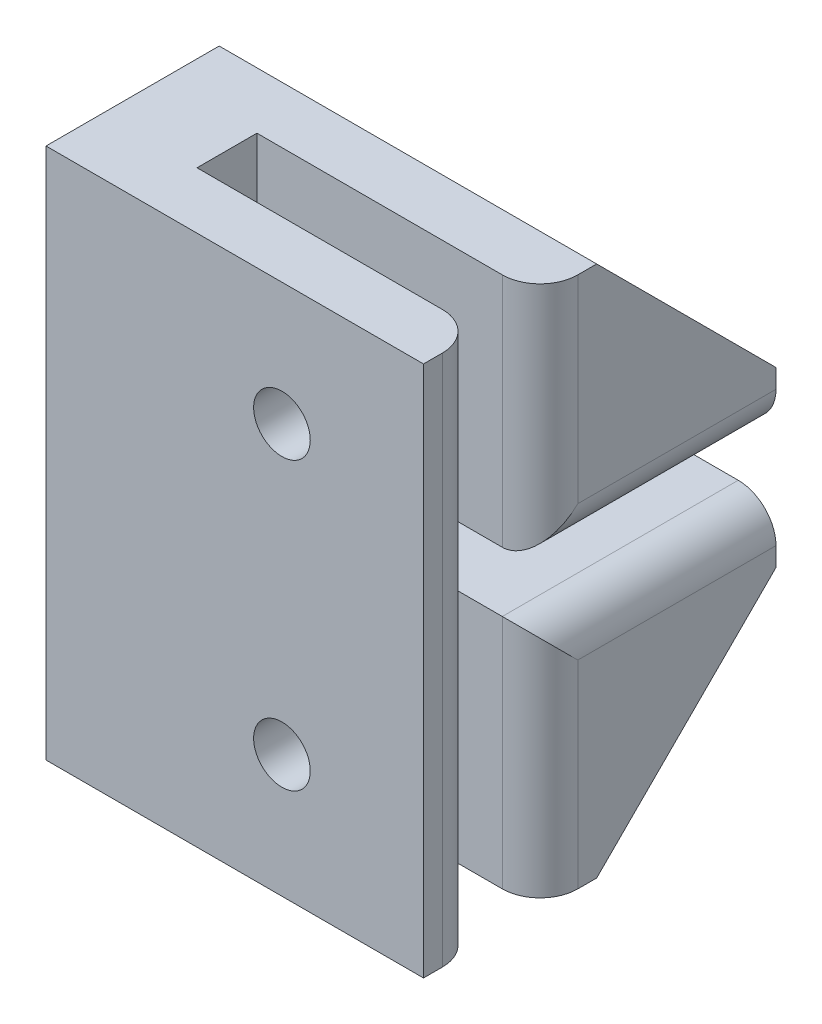
from build123d import *

# Parameters (mm, degrees)
BOSS_EXTRUDE1_DEPTH = 20
CUT_EXTRUDE1_DEPTH  = 15
FILLET1_R           = 2
SKETCH5_R           = 1.5
CUT_EXTRUDE4_DEPTH  = 32.535079673


with BuildPart() as part:
    # Sketch1 → Boss-Extrude1 (new body)
    with BuildSketch(Plane(origin=(0, 0, 0), x_dir=(0, 0, -1), z_dir=(1, 0, 0))):
        Polygon((0, -12.5), (-3.175, -12.5), (-6.175, -12.5), (-6.175, 15.675), (-3.175, 15.675), (0, 15.675), (3, 15.675), (12.5, 6.175), (12.5, 3.175), (12.5, 0), (12.5, -3), (3, -12.5), align=None)
    extrude(amount=BOSS_EXTRUDE1_DEPTH)

    # Sketch2 → Cut-Extrude1 (cut)
    with BuildSketch(Plane(origin=(20, 0, 0), x_dir=(0, 0, -1), z_dir=(1, 0, 0))):
        Polygon((-3.175, -12.5), (0, -12.5), (0, 0), (12.5, 0), (12.5, 3.175), (0, 3.175), (0, 15.675), (-3.175, 15.675), (-3.175, 3.175), align=None)
    extrude(amount=-CUT_EXTRUDE1_DEPTH, mode=Mode.SUBTRACT)

    # Fillet1
    fillet1_edges = [part.edges().sort_by_distance(p)[0] for p in [
        (20, 1.5875, 3.175),
        (20, -6.25, 0),
        (20, 0, -6.25),
        (20, 3.175, -6.25),
        (20, 9.425, 0),
    ]]
    fillet(fillet1_edges, radius=FILLET1_R)

    # Sketch5 → Cut-Extrude4 (cut, through all)
    with BuildSketch(Plane.XY.offset(6.175)):
        with Locations((12.5, 9.175)):
            Circle(SKETCH5_R)
        with Locations((12.5, -6)):
            Circle(SKETCH5_R)
    extrude(amount=-CUT_EXTRUDE4_DEPTH, mode=Mode.SUBTRACT)


solid = part.part
